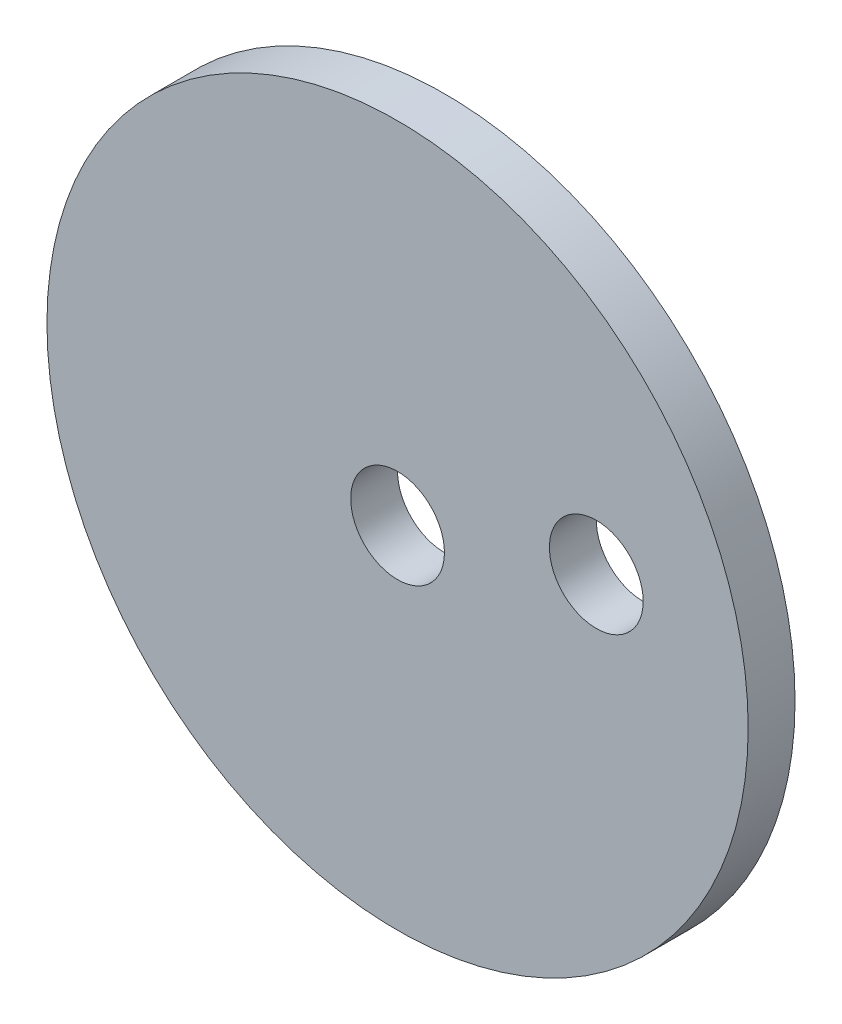
from build123d import *

# Parameters (mm, degrees)
SKETCH1_R           = 47.498
SKETCH1_R_2         = 6.35
BOSS_EXTRUDE1_DEPTH = 6.35


with BuildPart() as part:
    # Sketch1 → Boss-Extrude1 (new body)
    with BuildSketch(Plane.XY):
        Circle(SKETCH1_R)
        Circle(SKETCH1_R_2, mode=Mode.SUBTRACT)
        with Locations((26.921515892, 7.731784841)):
            Circle(SKETCH1_R_2, mode=Mode.SUBTRACT)
    extrude(amount=BOSS_EXTRUDE1_DEPTH)


solid = part.part
